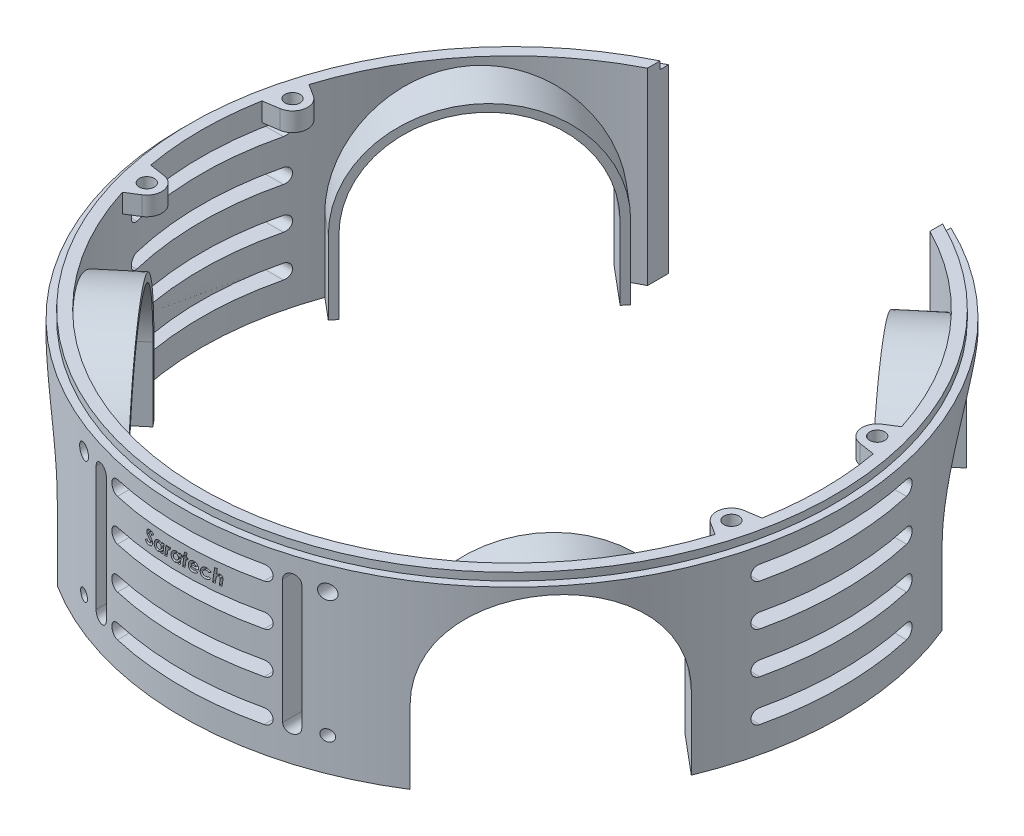
from build123d import *

# Parameters (mm, degrees)
SKETCH1_R                                     = 87.5
BOSS_EXTRUDE1_DEPTH                           = 50
SKETCH3_R                                     = 82.5
CUT_EXTRUDE1_DEPTH                            = 50
SKETCH6_W                                     = 75
SKETCH6_H                                     = 80.665083436
CUT_EXTRUDE2_DEPTH                            = 50
SKETCH7_R                                     = 2
BOSS_EXTRUDE10_DEPTH                          = 5
MIRROR1_AT_THE_SECOND_PLANE_COPY_1_SKETC_R    = 2
MIRROR1_AT_THE_SECOND_PLANE_COPY_1_DEPTH      = 5
CUT_EXTRUDE3_DEPTH                            = 134.46347815
BOSS_EXTRUDE11_REACH                          = 201.927
BOSS_EXTRUDE11_END_RADIUS                     = 82.5
MIRROR2_AT_THE_SECOND_PLANE_COPY_1_DEPTH      = 134.46347815
MIRROR2_AT_THE_SECOND_PLANE_COPY_2_REACH      = 201.927
MIRROR2_AT_THE_SECOND_PLANE_COPY_2_END_RADIUS = 82.5
CUT_EXTRUDE4_START                            = -2
SKETCH13_R                                    = 87.5
SKETCH13_R_2                                  = 85.5
CUT_EXTRUDE4_DEPTH                            = 2
CUT_EXTRUDE5_START                            = -157
CUT_EXTRUDE5_DEPTH                            = 313
CIRPATTERN1_COUNT                             = 2
CIRPATTERN1_ANGLE                             = 90
SKETCH15_R                                    = 1.9467493
SKETCH15_R_2                                  = 1.5
CUT_EXTRUDE6_DEPTH                            = 122


with BuildPart() as part:
    # Sketch1 → Boss-Extrude1 (new body)
    with BuildSketch(Plane(origin=(0, 0, 0), x_dir=(1, 0, 0), z_dir=(0, 1, 0))):
        with Locations(Location((0, 0, 0), (0, 0, 270))):
            Circle(SKETCH1_R)
    extrude(amount=BOSS_EXTRUDE1_DEPTH)

    # Sketch3 → Cut-Extrude1 (cut)
    with BuildSketch(Plane(origin=(0, 50, 0), x_dir=(1, 0, 0), z_dir=(0, 1, 0))):
        with Locations(Location((0, 0, 0), (0, 0, 270))):
            Circle(SKETCH3_R)
    extrude(amount=-CUT_EXTRUDE1_DEPTH, mode=Mode.SUBTRACT)

    # Sketch6 → Cut-Extrude2 (cut)
    with BuildSketch(Plane(origin=(0, 50, 0), x_dir=(1, 0, 0), z_dir=(0, 1, 0))):
        with Locations((0, 79.056941504)):
            Rectangle(SKETCH6_W, SKETCH6_H)
    extrude(amount=-CUT_EXTRUDE2_DEPTH, mode=Mode.SUBTRACT)

    # Sketch7 → Boss-Extrude10 (add)
    with BuildSketch(Plane(origin=(0, 50, 0), x_dir=(1, 0, 0), z_dir=(0, 1, 0))):
        with BuildLine():
            Line((-77.02286612, 15.399127899), (-81.167181464, 14.769517704))
            ThreePointArc((-81.167181464, 14.769517704), (-80.086745592, 19.808159443), (-78.693843423, 24.769517704))
            Line((-78.693843423, 24.769517704), (-75.481017933, 22.731486556))
            ThreePointArc((-75.481017933, 22.731486556), (-73.709264681, 18.530633102), (-77.02286612, 15.399127899))
        make_face()
        with Locations(Location((-77.623658102, 19.353751648, 0), (0, 0, 270))):
            Circle(SKETCH7_R, mode=Mode.SUBTRACT)
    boss_extrude10 = extrude(amount=-BOSS_EXTRUDE10_DEPTH)

    # Mirror1: Boss-Extrude10 across plane
    add(boss_extrude10.mirror(Plane(origin=(0, 0, 0), x_dir=(0, 0, 1), z_dir=(1, 0, 0))))

    # Mirror1 at the second plane: Boss-Extrude10 across plane
    add(boss_extrude10.mirror(Plane.XY))

    # Mirror1 at the second plane copy 1 sketc → Mirror1 at the second plane copy 1 (add)
    with BuildSketch(Plane(origin=(0, 50, 0), x_dir=(-1, 0, 0), z_dir=(0, 1, 0))):
        with BuildLine():
            Line((-77.02286612, 15.399127899), (-81.167181464, 14.769517704))
            ThreePointArc((-81.167181464, 14.769517704), (-80.086745592, 19.808159443), (-78.693843423, 24.769517704))
            Line((-78.693843423, 24.769517704), (-75.481017933, 22.731486556))
            ThreePointArc((-75.481017933, 22.731486556), (-73.709264681, 18.530633102), (-77.02286612, 15.399127899))
        make_face()
        with Locations(Location((-77.623658102, 19.353751648, 0), (0, 0, 270))):
            Circle(MIRROR1_AT_THE_SECOND_PLANE_COPY_1_SKETC_R, mode=Mode.SUBTRACT)
    extrude(amount=-MIRROR1_AT_THE_SECOND_PLANE_COPY_1_DEPTH)

    # Sketch9 → Cut-Extrude3 (cut, through all)
    with BuildSketch(Plane(origin=(0, 0, 0), x_dir=(0, 1, 0), z_dir=(0.7660444431189792, 0, 0.6427876096865379))):
        with BuildLine():
            Line((19.5, 26.5), (0, 26.5))
            Line((0, 26.5), (0, -26.5))
            Line((0, -26.5), (19.5, -26.5))
            ThreePointArc((19.5, -26.5), (46, 0), (19.5, 26.5))
        make_face()
    cut_extrude3 = extrude(amount=-CUT_EXTRUDE3_DEPTH, mode=Mode.SUBTRACT)

    # Boss-Extrude11: up to this cylinder (the profile starts inside it)
    boss_extrude11_end = Plane(origin=(0, 9.75, 0), z_dir=(0, 1, 0)) * Cylinder(BOSS_EXTRUDE11_END_RADIUS, 569.854, mode=Mode.PRIVATE)
    # Sketch10 → Boss-Extrude11 (add, up to the surface)
    with BuildSketch(Plane(origin=(-53.623111018, 0, -44.995132678), x_dir=(0, 1, 0), z_dir=(0.7660444431189792, 0, 0.6427876096865379)), mode=Mode.PRIVATE) as boss_extrude11_sk1:
        with BuildLine():
            Line((19.5, -26.5), (0, -26.5))
            Line((0, -26.5), (0, -28.5))
            Line((0, -28.5), (19.5, -28.5))
            ThreePointArc((19.5, -28.5), (48, 0), (19.5, 28.5))
            Line((19.5, 28.5), (0, 28.5))
            Line((0, 28.5), (0, 26.5))
            Line((0, 26.5), (19.5, 26.5))
            ThreePointArc((19.5, 26.5), (46, 0), (19.5, -26.5))
        make_face()
    boss_extrude11_tool1 = extrude(boss_extrude11_sk1.sketch, amount=-BOSS_EXTRUDE11_REACH, mode=Mode.PRIVATE) & boss_extrude11_end
    boss_extrude11 = boss_extrude11_tool1.solids().sort_by_distance((-36.110244, 9.75, -65.866155))[0]
    add(boss_extrude11)

    # Mirror2: Cut-Extrude3, Boss-Extrude11 across plane
    add(cut_extrude3.mirror(Plane.XY), mode=Mode.SUBTRACT)
    add(boss_extrude11.mirror(Plane.XY))

    # Mirror2 at the second plane: Cut-Extrude3, Boss-Extrude11 across plane
    add(cut_extrude3.mirror(Plane(origin=(0, 0, 0), x_dir=(0, 0, 1), z_dir=(1, 0, 0))), mode=Mode.SUBTRACT)
    add(boss_extrude11.mirror(Plane(origin=(0, 0, 0), x_dir=(0, 0, 1), z_dir=(1, 0, 0))))

    # Mirror2 at the second plane copy 1 sketc → Mirror2 at the second plane copy 1 (cut, through all)
    with BuildSketch(Plane(origin=(0, 0, 0), x_dir=(0, 1, 0), z_dir=(-0.7660444431189792, 0, -0.6427876096865379))):
        with BuildLine():
            Line((19.5, 26.5), (0, 26.5))
            Line((0, 26.5), (0, -26.5))
            Line((0, -26.5), (19.5, -26.5))
            ThreePointArc((19.5, -26.5), (46, 0), (19.5, 26.5))
        make_face()
    extrude(amount=-MIRROR2_AT_THE_SECOND_PLANE_COPY_1_DEPTH, mode=Mode.SUBTRACT)

    # Mirror2 at the second plane copy 2: up to this cylinder (the profile starts inside it)
    mirror2_at_the_second_plane_copy_2_end = Plane(origin=(0, 9.75, 0), z_dir=(0, 1, 0)) * Cylinder(MIRROR2_AT_THE_SECOND_PLANE_COPY_2_END_RADIUS, 569.854, mode=Mode.PRIVATE)
    # Mirror2 at the second plane copy 2 sketc → Mirror2 at the second plane copy 2 (add, up to the surface)
    with BuildSketch(Plane(origin=(53.623111018, 0, 44.995132678), x_dir=(0, 1, 0), z_dir=(-0.7660444431189792, 0, -0.6427876096865379)), mode=Mode.PRIVATE) as mirror2_at_the_second_plane_copy_2_sk1:
        with BuildLine():
            Line((19.5, -26.5), (0, -26.5))
            Line((0, -26.5), (0, -28.5))
            Line((0, -28.5), (19.5, -28.5))
            ThreePointArc((19.5, -28.5), (48, 0), (19.5, 28.5))
            Line((19.5, 28.5), (0, 28.5))
            Line((0, 28.5), (0, 26.5))
            Line((0, 26.5), (19.5, 26.5))
            ThreePointArc((19.5, 26.5), (46, 0), (19.5, -26.5))
        make_face()
    mirror2_at_the_second_plane_copy_2_tool1 = extrude(mirror2_at_the_second_plane_copy_2_sk1.sketch, amount=-MIRROR2_AT_THE_SECOND_PLANE_COPY_2_REACH, mode=Mode.PRIVATE) & mirror2_at_the_second_plane_copy_2_end
    add(mirror2_at_the_second_plane_copy_2_tool1.solids().sort_by_distance((-36.110244, 9.75, -65.866155))[0])

    # Sketch13 → Cut-Extrude4 (cut)
    with BuildSketch(Plane(origin=(0, 50, 0), x_dir=(1, 0, 0), z_dir=(0, 1, 0)).offset(CUT_EXTRUDE4_START)):
        Circle(SKETCH13_R)
        Circle(SKETCH13_R_2, mode=Mode.SUBTRACT)
    extrude(amount=CUT_EXTRUDE4_DEPTH, mode=Mode.SUBTRACT)

    # Sketch14 → Cut-Extrude5 (cut)
    with BuildSketch(Plane(origin=(0, 0, 0), x_dir=(0, 0, -1), z_dir=(1, 0, 0)).offset(CUT_EXTRUDE5_START)):
        with BuildLine():
            Line((-19.463993696, 43.831380894), (19.463993696, 43.831380894))
            ThreePointArc((19.463993696, 43.831380894), (21.410742996, 41.884631594), (19.463993696, 39.937882294))
            Line((19.463993696, 39.937882294), (-19.463993696, 39.937882294))
            ThreePointArc((-19.463993696, 39.937882294), (-21.410742996, 41.884631594), (-19.463993696, 43.831380894))
        make_face()
        with BuildLine():
            Line((-19.463993696, 28.937882294), (19.463993696, 28.937882294))
            ThreePointArc((19.463993696, 28.937882294), (21.410742996, 30.884631594), (19.463993696, 32.831380894))
            Line((19.463993696, 32.831380894), (-19.463993696, 32.831380894))
            ThreePointArc((-19.463993696, 32.831380894), (-21.410742996, 30.884631594), (-19.463993696, 28.937882294))
        make_face()
        with BuildLine():
            Line((-19.463993696, 17.937882294), (19.463993696, 17.937882294))
            ThreePointArc((19.463993696, 17.937882294), (21.410742996, 19.884631594), (19.463993696, 21.831380894))
            Line((19.463993696, 21.831380894), (-19.463993696, 21.831380894))
            ThreePointArc((-19.463993696, 21.831380894), (-21.410742996, 19.884631594), (-19.463993696, 17.937882294))
        make_face()
        with BuildLine():
            Line((-19.463993696, 6.937882294), (19.463993696, 6.937882294))
            ThreePointArc((19.463993696, 6.937882294), (21.410742996, 8.884631594), (19.463993696, 10.831380894))
            Line((19.463993696, 10.831380894), (-19.463993696, 10.831380894))
            ThreePointArc((-19.463993696, 10.831380894), (-21.410742996, 8.884631594), (-19.463993696, 6.937882294))
        make_face()
    cut_extrude5 = extrude(amount=CUT_EXTRUDE5_DEPTH, mode=Mode.SUBTRACT)

    # CirPattern1: Cut-Extrude5 ×2 about axis
    cirpattern1_axis = Axis((0, 0, 0), (0, -1, 0))
    for i in range(1, CIRPATTERN1_COUNT):
        add(cut_extrude5.rotate(cirpattern1_axis, i * CIRPATTERN1_ANGLE / (CIRPATTERN1_COUNT - 1)), mode=Mode.SUBTRACT)

    # Sketch15 → Cut-Extrude6 (cut)
    # profile 1 of 14: a face of its own
    with BuildSketch(Plane.XY):
        with Locations(Location((32.357492296, 41.884631594, 0), (0, 0, 180))):
            Circle(SKETCH15_R)
    # profile 2 of 14: a face of its own
    with BuildSketch(Plane.XY):
        with Locations(Location((32.357492296, 8.884631594, 0), (0, 0, 180))):
            Circle(SKETCH15_R_2)
    # profile 3 of 14: a face of its own
    with BuildSketch(Plane.XY):
        with Locations(Location((-32.357492296, 8.884631594, 0), (0, 0, 180))):
            Circle(SKETCH15_R_2)
    # profile 4 of 14: a face of its own
    with BuildSketch(Plane.XY):
        with Locations(Location((-32.357492296, 41.884631594, 0), (0, 0, 180))):
            Circle(SKETCH15_R)
    # profile 5 of 14: a face of its own
    with BuildSketch(Plane.XY):
        with BuildLine():
            Line((-23.410742996, 41.884631594), (-23.410742996, 8.884631594))
            ThreePointArc((-23.410742996, 8.884631594), (-25.357492296, 6.937882294), (-27.304241596, 8.884631594))
            Line((-27.304241596, 8.884631594), (-27.304241596, 41.884631594))
            ThreePointArc((-27.304241596, 41.884631594), (-25.357492296, 43.831380894), (-23.410742996, 41.884631594))
        make_face()
    # profile 6 of 14: a face of its own
    with BuildSketch(Plane.XY):
        with BuildLine():
            Line((23.410742996, 41.884631594), (23.410742996, 8.884631594))
            ThreePointArc((23.410742996, 8.884631594), (25.357492296, 6.937882294), (27.304241596, 8.884631594))
            Line((27.304241596, 8.884631594), (27.304241596, 41.884631594))
            ThreePointArc((27.304241596, 41.884631594), (25.357492296, 43.831380894), (23.410742996, 41.884631594))
        make_face()
    # profile 7 of 14: a face of its own
    with BuildSketch(Plane.XY):
        with BuildLine():
            Line((-8.084392004, 37.731021426), (-8.570970529, 37.30684274))
            add(Edge.make_bspline(
                [(-8.570970529, 37.30684274), (-8.59528857, 37.339692663), (-8.641893646, 37.402648934), (-8.715846339, 37.487090258), (-8.786695733, 37.560468751), (-8.858061527, 37.618984947), (-8.927622856, 37.665384903), (-8.995985893, 37.698996081), (-9.063534914, 37.720235709), (-9.108592898, 37.722776711), (-9.130465722, 37.724010208)],
                knots=[0, 0, 0, 0, 1.358515141, 2.603569235, 3.730126198, 4.746094498, 5.666493297, 6.504166865, 7.273866877, 8, 8, 8, 8], degree=3))
            add(Edge.make_bspline(
                [(-9.130465722, 37.724010208), (-9.151126472, 37.723115742), (-9.190859848, 37.721395565), (-9.247894466, 37.706729981), (-9.299731485, 37.683139484), (-9.344235642, 37.649012923), (-9.38140546, 37.609666408), (-9.409004554, 37.565512278), (-9.425077909, 37.516844696), (-9.427305908, 37.483173957), (-9.428442484, 37.465997388)],
                knots=[0, 0, 0, 0, 1.130304997, 2.173727141, 3.204821236, 4.229135679, 5.225705988, 6.15679035, 7.05971714, 8, 8, 8, 8], degree=3))
            add(Edge.make_bspline(
                [(-9.428442484, 37.465997388), (-9.427407379, 37.449076049), (-9.42523024, 37.413485365), (-9.409279374, 37.359530429), (-9.385151579, 37.302680665), (-9.356131008, 37.253249721), (-9.323547158, 37.208364882), (-9.289401325, 37.164445404), (-9.244815931, 37.111934269), (-9.190563034, 37.050230267), (-9.127160939, 36.978812777), (-9.052965201, 36.898720932), (-8.969311745, 36.809428724), (-8.909894396, 36.747068254), (-8.878762997, 36.714394823)],
                knots=[0, 0, 0, 0, 0.642317819, 1.35098826, 2.122816345, 2.986294386, 3.520967692, 4.229638134, 5.099348126, 6.137609051, 7.351336444, 8.727500291, 10.285391505, 12, 12, 12, 12], degree=3))
            add(Edge.make_bspline(
                [(-8.878762997, 36.714394823), (-8.861875011, 36.69692504), (-8.829470247, 36.663403921), (-8.78400207, 36.614447423), (-8.743420788, 36.569074046), (-8.705952519, 36.528872928), (-8.673877282, 36.491768355), (-8.646491082, 36.458650523), (-8.623241851, 36.429985447), (-8.609496663, 36.412005514), (-8.603222132, 36.403797868)],
                knots=[0, 0, 0, 0, 1.403722598, 2.693470914, 3.859630393, 4.920438112, 5.867965235, 6.69256451, 7.40316977, 8, 8, 8, 8], degree=3))
            add(Edge.make_bspline(
                [(-8.603222132, 36.403797868), (-8.578236564, 36.369280001), (-8.530046852, 36.302705325), (-8.467541217, 36.201483467), (-8.41584208, 36.103958145), (-8.375216966, 36.008975158), (-8.344826696, 35.915495623), (-8.32281593, 35.821974323), (-8.308950895, 35.727633351), (-8.307413113, 35.664160403), (-8.306647613, 35.632563894)],
                knots=[0, 0, 0, 0, 1.215130546, 2.343624586, 3.390252636, 4.360992906, 5.286454858, 6.190345157, 7.099163061, 8, 8, 8, 8], degree=3))
            add(Edge.make_bspline(
                [(-8.306647613, 35.632563894), (-8.307600189, 35.597690223), (-8.309474864, 35.529058664), (-8.324001291, 35.428363271), (-8.346627322, 35.331812535), (-8.380366167, 35.239986518), (-8.422025404, 35.151885992), (-8.47489983, 35.068801043), (-8.535725056, 34.989325875), (-8.605944287, 34.915338059), (-8.682800363, 34.847676538), (-8.766488132, 34.789083916), (-8.854946032, 34.739141474), (-8.949073286, 34.698025426), (-9.048583062, 34.6667533), (-9.15329784, 34.644510463), (-9.263024315, 34.629745748), (-9.338181787, 34.628495021), (-9.376559472, 34.627856362)],
                knots=[0, 0, 0, 0, 1.018989505, 2.005376454, 2.968035412, 3.912365187, 4.859556873, 5.811049809, 6.78527381, 7.780773345, 8.787785161, 9.773320145, 10.761314359, 11.752515283, 12.770107012, 13.804505292, 14.878913802, 16, 16, 16, 16], degree=3))
            add(Edge.make_bspline(
                [(-9.376559472, 34.627856362), (-9.40602215, 34.628446705), (-9.464346259, 34.629615344), (-9.550793265, 34.63737452), (-9.63514424, 34.650620444), (-9.717275227, 34.669735295), (-9.797357716, 34.693602903), (-9.875516558, 34.722251872), (-9.951556188, 34.756928111), (-10.025573987, 34.796729932), (-10.097576797, 34.841812999), (-10.167132575, 34.892715065), (-10.23499178, 34.94845453), (-10.300264997, 35.010087056), (-10.364330374, 35.075911369), (-10.426065813, 35.147424899), (-10.484850985, 35.224927376), (-10.522167884, 35.279050667), (-10.541122773, 35.306542259)],
                knots=[0, 0, 0, 0, 1.003438088, 1.986398949, 2.953471805, 3.909242729, 4.856156023, 5.798037682, 6.742035895, 7.700024963, 8.658509928, 9.632892881, 10.633707184, 11.647385023, 12.688779161, 13.761077638, 14.862753205, 16, 16, 16, 16], degree=3))
            Line((-10.541122773, 35.306542259), (-10.022993767, 35.713894022))
            add(Edge.make_bspline(
                [(-10.022993767, 35.713894022), (-9.997186529, 35.674212077), (-9.947689888, 35.598104629), (-9.867012646, 35.495373061), (-9.784762534, 35.408062687), (-9.700640906, 35.336512982), (-9.614377123, 35.280841805), (-9.526590417, 35.241047601), (-9.436890089, 35.21545203), (-9.376022386, 35.212606685), (-9.345710113, 35.211189695)],
                knots=[0, 0, 0, 0, 1.289844872, 2.473840458, 3.555310637, 4.554525788, 5.477014656, 6.343795492, 7.175205895, 8, 8, 8, 8], degree=3))
            add(Edge.make_bspline(
                [(-9.345710113, 35.211189695), (-9.317741816, 35.212415414), (-9.263296233, 35.214801509), (-9.185412082, 35.237017692), (-9.113956326, 35.271265378), (-9.052094275, 35.320165693), (-8.999979831, 35.377595847), (-8.962097285, 35.443021089), (-8.939291065, 35.514705771), (-8.936354401, 35.564389664), (-8.934852741, 35.589795464)],
                knots=[0, 0, 0, 0, 1.07813582, 2.098795369, 3.104167493, 4.120866408, 5.124778177, 6.083335831, 7.019916046, 8, 8, 8, 8], degree=3))
            add(Edge.make_bspline(
                [(-8.934852741, 35.589795464), (-8.935570121, 35.610445307), (-8.937029403, 35.652450892), (-8.952241035, 35.715013612), (-8.974817613, 35.778451927), (-9.002181087, 35.83206689), (-9.031694369, 35.879080159), (-9.062949226, 35.921654005), (-9.102276797, 35.971625739), (-9.15093053, 36.027822435), (-9.206921603, 36.092141292), (-9.272371522, 36.162321847), (-9.345189129, 36.240686583), (-9.39747281, 36.294303395), (-9.424936875, 36.32246774)],
                knots=[0, 0, 0, 0, 0.82235112, 1.672813781, 2.554588539, 3.50524042, 4.06657461, 4.767804758, 5.610876414, 6.602916144, 7.732569792, 9.01260869, 10.430754915, 12, 12, 12, 12], degree=3))
            add(Edge.make_bspline(
                [(-9.424936875, 36.32246774), (-9.454004804, 36.352531701), (-9.510197756, 36.410650144), (-9.589695736, 36.495706098), (-9.66130452, 36.574871571), (-9.724943025, 36.648229865), (-9.780663818, 36.715912847), (-9.829431065, 36.777407061), (-9.869768725, 36.833523705), (-9.892518916, 36.869933522), (-9.90310194, 36.886870785)],
                knots=[0, 0, 0, 0, 1.354401886, 2.618275412, 3.770529779, 4.811580489, 5.763301005, 6.60974666, 7.35327647, 8, 8, 8, 8], degree=3))
            add(Edge.make_bspline(
                [(-9.90310194, 36.886870785), (-9.926731814, 36.929075873), (-9.972577851, 37.010961029), (-10.019841716, 37.139840603), (-10.050641721, 37.267064414), (-10.054668047, 37.352015274), (-10.056647613, 37.393781843)],
                knots=[0, 0, 0, 0, 1.081804801, 2.098888081, 3.065307629, 4, 4, 4, 4], degree=3))
            add(Edge.make_bspline(
                [(-10.056647613, 37.393781843), (-10.055936816, 37.420690494), (-10.05452291, 37.474216828), (-10.044343873, 37.553214656), (-10.0287582, 37.63046244), (-10.003912067, 37.704788468), (-9.975257309, 37.778053866), (-9.937801983, 37.848333511), (-9.895720787, 37.917518152), (-9.861960343, 37.960376437), (-9.844908831, 37.982023029)],
                knots=[0, 0, 0, 0, 1.012167245, 2.013389743, 2.992947912, 3.971795425, 4.958040075, 5.949133471, 6.964161297, 8, 8, 8, 8], degree=3))
            add(Edge.make_bspline(
                [(-9.844908831, 37.982023029), (-9.822399358, 38.008111342), (-9.778002566, 38.059566899), (-9.701187687, 38.125341725), (-9.619742556, 38.18215621), (-9.531914023, 38.22776679), (-9.43871204, 38.264118953), (-9.339250189, 38.28878633), (-9.23429073, 38.304901423), (-9.162312038, 38.30651805), (-9.125557869, 38.307343541)],
                knots=[0, 0, 0, 0, 1.010152455, 1.992384693, 2.959065588, 3.919519142, 4.890305168, 5.888624478, 6.921877408, 8, 8, 8, 8], degree=3))
            add(Edge.make_bspline(
                [(-9.125557869, 38.307343541), (-9.074732478, 38.305569152), (-8.974471958, 38.302068909), (-8.826973853, 38.274863365), (-8.686416766, 38.228747643), (-8.551394963, 38.16609195), (-8.424100765, 38.083578024), (-8.302834117, 37.983833895), (-8.187661934, 37.86614861), (-8.119456672, 37.776903028), (-8.084392004, 37.731021426)],
                knots=[0, 0, 0, 0, 0.984438778, 1.941949542, 2.894274057, 3.844399604, 4.817935388, 5.825099055, 6.88187249, 8, 8, 8, 8], degree=3))
        make_face()
    # profile 8 of 14: a face of its own
    with BuildSketch(Plane.XY):
        with BuildLine():
            Line((-5.655004984, 37.275292259), (-5.02048976, 37.275292259))
            Line((-5.02048976, 37.275292259), (-5.38367085, 34.717599952))
            Line((-5.38367085, 34.717599952), (-6.018186074, 34.717599952))
            Line((-6.018186074, 34.717599952), (-5.974015401, 35.030300272))
            add(Edge.make_bspline(
                [(-5.974015401, 35.030300272), (-6.006972033, 34.998930039), (-6.069814483, 34.939112569), (-6.167146274, 34.861509269), (-6.260839522, 34.798396094), (-6.353210501, 34.749989105), (-6.446796385, 34.714869052), (-6.543938822, 34.69054379), (-6.646613078, 34.675330351), (-6.716916223, 34.673610137), (-6.752961715, 34.672728157)],
                knots=[0, 0, 0, 0, 1.236324186, 2.357450916, 3.379388742, 4.30284698, 5.185433758, 6.089881904, 7.020653398, 8, 8, 8, 8], degree=3))
            add(Edge.make_bspline(
                [(-6.752961715, 34.672728157), (-6.794162537, 34.673687986), (-6.874852175, 34.675567762), (-6.992556083, 34.693758481), (-7.103828228, 34.722208375), (-7.208721008, 34.762352046), (-7.306667652, 34.814750942), (-7.398605898, 34.878270954), (-7.483704357, 34.953694023), (-7.560795939, 35.040022492), (-7.630320758, 35.133068096), (-7.690793332, 35.2313901), (-7.743302799, 35.332688074), (-7.784173303, 35.438812624), (-7.817911504, 35.547779008), (-7.840497115, 35.661040517), (-7.855066474, 35.777783953), (-7.856967882, 35.856878627), (-7.857929664, 35.896886811)],
                knots=[0, 0, 0, 0, 1.072254913, 2.099954687, 3.093402483, 4.05863531, 5.017013142, 5.979305845, 6.962352722, 7.970695896, 8.988290287, 9.983079422, 10.973839091, 11.95483031, 12.940586347, 13.940815436, 14.958409826, 16, 16, 16, 16], degree=3))
            add(Edge.make_bspline(
                [(-7.857929664, 35.896886811), (-7.857447078, 35.927758657), (-7.856487068, 35.989172216), (-7.84700534, 36.0807776), (-7.83155604, 36.171135553), (-7.81033769, 36.260545919), (-7.783889273, 36.348984181), (-7.750826936, 36.436132499), (-7.711167765, 36.521815397), (-7.666589008, 36.606135438), (-7.617383552, 36.688075647), (-7.562186047, 36.764983656), (-7.504243617, 36.838265012), (-7.441697675, 36.906482865), (-7.374705853, 36.969414515), (-7.304649122, 37.0290444), (-7.229271624, 37.082483607), (-7.15122763, 37.1325232), (-7.07006381, 37.176093959), (-6.987979768, 37.215248524), (-6.904341465, 37.247167613), (-6.820203655, 37.274187321), (-6.734832911, 37.294477853), (-6.648646073, 37.30906276), (-6.561541837, 37.318741973), (-6.503154062, 37.319689541), (-6.473915241, 37.320164054)],
                knots=[0, 0, 0, 0, 1.010861959, 2.01091412, 3.012605424, 4.011485121, 5.018863341, 6.033918867, 7.061452407, 8.109228878, 9.15680961, 10.18900835, 11.207521355, 12.215190347, 13.216881651, 14.216552911, 15.225616441, 16.240671966, 17.251099115, 18.240697123, 19.217272556, 20.180771028, 21.133199006, 22.08832996, 23.042693801, 24, 24, 24, 24], degree=3))
            add(Edge.make_bspline(
                [(-6.473915241, 37.320164054), (-6.435031333, 37.319056242), (-6.358385569, 37.316872585), (-6.246126638, 37.296402465), (-6.138584683, 37.264026686), (-6.036025905, 37.219129816), (-5.939710701, 37.161921272), (-5.852451643, 37.091452184), (-5.772277087, 37.010678382), (-5.728453028, 36.948108461), (-5.706186875, 36.9163179)],
                knots=[0, 0, 0, 0, 1.030509072, 2.031281277, 3.015697838, 4.003854478, 4.993584726, 5.977161716, 6.972235198, 8, 8, 8, 8], degree=3))
            Line((-5.706186875, 36.9163179), (-5.655004984, 37.275292259))
        make_face()
        with BuildLine():
            add(Edge.make_bspline(
                [(-6.612036234, 35.25606149), (-6.575487508, 35.257191159), (-6.504210672, 35.259394223), (-6.401234732, 35.278909805), (-6.305275486, 35.309641821), (-6.216477932, 35.353573305), (-6.134536698, 35.411352324), (-6.060157915, 35.483464887), (-5.992978165, 35.56985071), (-5.934062667, 35.667907157), (-5.884825227, 35.773366005), (-5.84874975, 35.882240499), (-5.825743448, 35.992440918), (-5.823160472, 36.066682714), (-5.821871972, 36.10371774)],
                knots=[0, 0, 0, 0, 1.017901168, 1.985097214, 2.910041334, 3.818973104, 4.735274743, 5.693545178, 6.695670165, 7.777101795, 8.875856117, 9.932619244, 10.968700869, 12, 12, 12, 12], degree=3))
            add(Edge.make_bspline(
                [(-5.821871972, 36.10371774), (-5.822461407, 36.126873719), (-5.823619776, 36.172380307), (-5.831191728, 36.238833271), (-5.84450273, 36.30178398), (-5.863601722, 36.361193543), (-5.887997814, 36.417125852), (-5.917871814, 36.469744879), (-5.952797146, 36.518682189), (-5.99294111, 36.563895982), (-6.037802102, 36.603953521), (-6.085367216, 36.640677254), (-6.137847717, 36.669514515), (-6.192699723, 36.694678527), (-6.251422159, 36.71324034), (-6.313215855, 36.727702857), (-6.378852963, 36.735053821), (-6.423653346, 36.73622936), (-6.446571491, 36.736830721)],
                knots=[0, 0, 0, 0, 1.109141645, 2.179707075, 3.198451464, 4.18615572, 5.163657463, 6.116161664, 7.079133258, 8.038519567, 9.005387219, 9.956904198, 10.909408399, 11.866440704, 12.843493655, 13.853714903, 14.902043453, 16, 16, 16, 16], degree=3))
            add(Edge.make_bspline(
                [(-6.446571491, 36.736830721), (-6.473259692, 36.736248168), (-6.525945661, 36.735098134), (-6.603367061, 36.723220493), (-6.678040216, 36.705485717), (-6.749242137, 36.678946426), (-6.817715734, 36.646236189), (-6.88239629, 36.604908993), (-6.944541341, 36.557022126), (-7.002831463, 36.502120957), (-7.055999319, 36.441374442), (-7.102532552, 36.375841688), (-7.142131825, 36.305896383), (-7.174398609, 36.231647901), (-7.198828512, 36.15277805), (-7.217210494, 36.070305974), (-7.2277977, 35.983166685), (-7.229071915, 35.923791607), (-7.229724536, 35.893381202)],
                knots=[0, 0, 0, 0, 0.994897251, 1.964056203, 2.915642991, 3.853470011, 4.79324038, 5.741466074, 6.711095529, 7.716481674, 8.723680824, 9.71796663, 10.70964959, 11.717112863, 12.731868792, 13.785363818, 14.865719672, 16, 16, 16, 16], degree=3))
            add(Edge.make_bspline(
                [(-7.229724536, 35.893381202), (-7.22912458, 35.869995076), (-7.227951318, 35.824261564), (-7.220573544, 35.757244243), (-7.206206065, 35.694007531), (-7.187339793, 35.634139581), (-7.163539487, 35.577582743), (-7.133895565, 35.524682764), (-7.098602401, 35.475340869), (-7.05816828, 35.429958111), (-7.013143606, 35.389556831), (-6.965429515, 35.353254825), (-6.914002074, 35.323198183), (-6.859563273, 35.298343781), (-6.801913748, 35.279457114), (-6.74125785, 35.266425616), (-6.677735726, 35.257512591), (-6.63427027, 35.256552572), (-6.612036234, 35.25606149)],
                knots=[0, 0, 0, 0, 1.124431694, 2.198919568, 3.234766021, 4.236791382, 5.213425507, 6.179206721, 7.145706547, 8.12447102, 9.094881178, 10.04988442, 11.001776355, 11.952075609, 12.922030374, 13.911569148, 14.931697721, 16, 16, 16, 16], degree=3))
        make_face(mode=Mode.SUBTRACT)
    # profile 9 of 14: a face of its own
    with BuildSketch(Plane.XY):
        with BuildLine():
            Line((-4.488338318, 37.275292259), (-3.89939601, 37.275292259))
            Line((-3.89939601, 37.275292259), (-3.944968927, 36.9163179))
            add(Edge.make_bspline(
                [(-3.944968927, 36.9163179), (-3.923804733, 36.948277161), (-3.883019466, 37.009865474), (-3.814665869, 37.092561906), (-3.743015699, 37.162467876), (-3.66824426, 37.220226707), (-3.589875491, 37.264872204), (-3.508243395, 37.296890998), (-3.423332771, 37.316583577), (-3.365477804, 37.318966303), (-3.336395209, 37.320164054)],
                knots=[0, 0, 0, 0, 1.203274242, 2.318815539, 3.362160423, 4.341361458, 5.27818761, 6.184615762, 7.087440759, 8, 8, 8, 8], degree=3))
            add(Edge.make_bspline(
                [(-3.336395209, 37.320164054), (-3.32209968, 37.319598565), (-3.292806681, 37.318439819), (-3.248595156, 37.309518078), (-3.203389185, 37.295592155), (-3.174067936, 37.282179628), (-3.159011395, 37.275292259)],
                knots=[0, 0, 0, 0, 0.929430428, 1.904497954, 2.92395396, 4, 4, 4, 4], degree=3))
            Line((-3.159011395, 37.275292259), (-3.40720851, 36.705981362))
            add(Edge.make_bspline(
                [(-3.40720851, 36.705981362), (-3.418625164, 36.710512777), (-3.439659158, 36.718861438), (-3.469196527, 36.729110537), (-3.494162543, 36.734960141), (-3.509319674, 36.73626552), (-3.515882388, 36.736830721)],
                knots=[0, 0, 0, 0, 1.298729578, 2.392773935, 3.304105365, 4, 4, 4, 4], degree=3))
            add(Edge.make_bspline(
                [(-3.515882388, 36.736830721), (-3.531596877, 36.736138517), (-3.562634562, 36.734771345), (-3.60837046, 36.724321247), (-3.653016473, 36.708116242), (-3.696621904, 36.684984088), (-3.738121198, 36.65396744), (-3.778885096, 36.617514959), (-3.818317734, 36.574295938), (-3.85678629, 36.523702187), (-3.894108459, 36.46320113), (-3.92697361, 36.389266271), (-3.959020692, 36.302797557), (-3.990064536, 36.203002682), (-4.01724236, 36.089190172), (-4.044020246, 35.962303279), (-4.068435255, 35.821972709), (-4.082213853, 35.723753568), (-4.089400017, 35.672527836)],
                knots=[0, 0, 0, 0, 0.576935763, 1.139505725, 1.715418098, 2.31853603, 2.945453378, 3.61436612, 4.325438415, 5.091425351, 5.947081821, 6.930670679, 8.058330957, 9.334895625, 10.767784451, 12.355934311, 14.099454639, 16, 16, 16, 16], degree=3))
            Line((-4.089400017, 35.672527836), (-4.217705305, 34.717599952))
            Line((-4.217705305, 34.717599952), (-4.851519408, 34.717599952))
            Line((-4.851519408, 34.717599952), (-4.488338318, 37.275292259))
        make_face()
    # profile 10 of 14: a face of its own
    with BuildSketch(Plane.XY):
        with BuildLine():
            Line((-0.898594728, 37.275292259), (-0.264079504, 37.275292259))
            Line((-0.264079504, 37.275292259), (-0.627260593, 34.717599952))
            Line((-0.627260593, 34.717599952), (-1.261775818, 34.717599952))
            Line((-1.261775818, 34.717599952), (-1.217605145, 35.030300272))
            add(Edge.make_bspline(
                [(-1.217605145, 35.030300272), (-1.250561776, 34.998930039), (-1.313404226, 34.939112569), (-1.410736018, 34.861509269), (-1.504429265, 34.798396094), (-1.596800245, 34.749989105), (-1.690386128, 34.714869052), (-1.787528566, 34.69054379), (-1.890202822, 34.675330351), (-1.960505967, 34.673610137), (-1.996551459, 34.672728157)],
                knots=[0, 0, 0, 0, 1.236324186, 2.357450916, 3.379388742, 4.30284698, 5.185433758, 6.089881904, 7.020653398, 8, 8, 8, 8], degree=3))
            add(Edge.make_bspline(
                [(-1.996551459, 34.672728157), (-2.037752281, 34.673687986), (-2.118441918, 34.675567762), (-2.236145827, 34.693758481), (-2.347417971, 34.722208375), (-2.452310751, 34.762352046), (-2.550257396, 34.814750942), (-2.642195641, 34.878270954), (-2.727294101, 34.953694023), (-2.804385682, 35.040022492), (-2.873910502, 35.133068096), (-2.934383076, 35.2313901), (-2.986892542, 35.332688074), (-3.027763047, 35.438812624), (-3.061501248, 35.547779008), (-3.084086859, 35.661040517), (-3.098656217, 35.777783953), (-3.100557625, 35.856878627), (-3.101519408, 35.896886811)],
                knots=[0, 0, 0, 0, 1.072254913, 2.099954687, 3.093402483, 4.05863531, 5.017013142, 5.979305845, 6.962352722, 7.970695896, 8.988290287, 9.983079422, 10.973839091, 11.95483031, 12.940586347, 13.940815436, 14.958409826, 16, 16, 16, 16], degree=3))
            add(Edge.make_bspline(
                [(-3.101519408, 35.896886811), (-3.101036822, 35.927758657), (-3.100076811, 35.989172216), (-3.090595084, 36.0807776), (-3.075145783, 36.171135553), (-3.053927433, 36.260545919), (-3.027479016, 36.348984181), (-2.994416679, 36.436132499), (-2.954757508, 36.521815397), (-2.910178752, 36.606135438), (-2.860973295, 36.688075647), (-2.80577579, 36.764983656), (-2.74783336, 36.838265012), (-2.685287418, 36.906482865), (-2.618295597, 36.969414515), (-2.548238866, 37.0290444), (-2.472861367, 37.082483607), (-2.394817373, 37.1325232), (-2.313653554, 37.176093959), (-2.231569511, 37.215248524), (-2.147931209, 37.247167613), (-2.063793399, 37.274187321), (-1.978422654, 37.294477853), (-1.892235816, 37.30906276), (-1.805131581, 37.318741973), (-1.746743806, 37.319689541), (-1.717504984, 37.320164054)],
                knots=[0, 0, 0, 0, 1.010861959, 2.01091412, 3.012605424, 4.011485121, 5.018863341, 6.033918867, 7.061452407, 8.109228878, 9.15680961, 10.18900835, 11.207521355, 12.215190347, 13.216881651, 14.216552911, 15.225616441, 16.240671966, 17.251099115, 18.240697123, 19.217272556, 20.180771028, 21.133199006, 22.08832996, 23.042693801, 24, 24, 24, 24], degree=3))
            add(Edge.make_bspline(
                [(-1.717504984, 37.320164054), (-1.678621076, 37.319056242), (-1.601975313, 37.316872585), (-1.489716382, 37.296402465), (-1.382174426, 37.264026686), (-1.279615648, 37.219129816), (-1.183300445, 37.161921272), (-1.096041387, 37.091452184), (-1.01586683, 37.010678382), (-0.972042771, 36.948108461), (-0.949776619, 36.9163179)],
                knots=[0, 0, 0, 0, 1.030509072, 2.031281277, 3.015697838, 4.003854478, 4.993584726, 5.977161716, 6.972235198, 8, 8, 8, 8], degree=3))
            Line((-0.949776619, 36.9163179), (-0.898594728, 37.275292259))
        make_face()
        with BuildLine():
            add(Edge.make_bspline(
                [(-1.855625978, 35.25606149), (-1.819077252, 35.257191159), (-1.747800415, 35.259394223), (-1.644824476, 35.278909805), (-1.54886523, 35.309641821), (-1.460067676, 35.353573305), (-1.378126441, 35.411352324), (-1.303747659, 35.483464887), (-1.236567909, 35.56985071), (-1.17765241, 35.667907157), (-1.128414971, 35.773366005), (-1.092339494, 35.882240499), (-1.069333191, 35.992440918), (-1.066750216, 36.066682714), (-1.065461715, 36.10371774)],
                knots=[0, 0, 0, 0, 1.017901168, 1.985097214, 2.910041334, 3.818973104, 4.735274743, 5.693545178, 6.695670165, 7.777101795, 8.875856117, 9.932619244, 10.968700869, 12, 12, 12, 12], degree=3))
            add(Edge.make_bspline(
                [(-1.065461715, 36.10371774), (-1.06605115, 36.126873719), (-1.06720952, 36.172380307), (-1.074781472, 36.238833271), (-1.088092474, 36.30178398), (-1.107191465, 36.361193543), (-1.131587558, 36.417125852), (-1.161461558, 36.469744879), (-1.19638689, 36.518682189), (-1.236530854, 36.563895982), (-1.281391846, 36.603953521), (-1.32895696, 36.640677254), (-1.381437461, 36.669514515), (-1.436289466, 36.694678527), (-1.495011903, 36.71324034), (-1.556805598, 36.727702857), (-1.622442707, 36.735053821), (-1.667243089, 36.73622936), (-1.690161234, 36.736830721)],
                knots=[0, 0, 0, 0, 1.109141645, 2.179707075, 3.198451464, 4.18615572, 5.163657463, 6.116161664, 7.079133258, 8.038519567, 9.005387219, 9.956904198, 10.909408399, 11.866440704, 12.843493655, 13.853714903, 14.902043453, 16, 16, 16, 16], degree=3))
            add(Edge.make_bspline(
                [(-1.690161234, 36.736830721), (-1.716849435, 36.736248168), (-1.769535405, 36.735098134), (-1.846956805, 36.723220493), (-1.92162996, 36.705485717), (-1.99283188, 36.678946426), (-2.061305477, 36.646236189), (-2.125986033, 36.604908993), (-2.188131084, 36.557022126), (-2.246421207, 36.502120957), (-2.299589062, 36.441374442), (-2.346122295, 36.375841688), (-2.385721569, 36.305896383), (-2.417988352, 36.231647901), (-2.442418255, 36.15277805), (-2.460800238, 36.070305974), (-2.471387444, 35.983166685), (-2.472661659, 35.923791607), (-2.473314279, 35.893381202)],
                knots=[0, 0, 0, 0, 0.994897251, 1.964056203, 2.915642991, 3.853470011, 4.79324038, 5.741466074, 6.711095529, 7.716481674, 8.723680824, 9.71796663, 10.70964959, 11.717112863, 12.731868792, 13.785363818, 14.865719672, 16, 16, 16, 16], degree=3))
            add(Edge.make_bspline(
                [(-2.473314279, 35.893381202), (-2.472714324, 35.869995076), (-2.471541062, 35.824261564), (-2.464163288, 35.757244243), (-2.449795809, 35.694007531), (-2.430929537, 35.634139581), (-2.40712923, 35.577582743), (-2.377485309, 35.524682764), (-2.342192144, 35.475340869), (-2.301758024, 35.429958111), (-2.25673335, 35.389556831), (-2.209019258, 35.353254825), (-2.157591817, 35.323198183), (-2.103153016, 35.298343781), (-2.045503492, 35.279457114), (-1.984847594, 35.266425616), (-1.92132547, 35.257512591), (-1.877860014, 35.256552572), (-1.855625978, 35.25606149)],
                knots=[0, 0, 0, 0, 1.124431694, 2.198919568, 3.234766021, 4.236791382, 5.213425507, 6.179206721, 7.145706547, 8.12447102, 9.094881178, 10.04988442, 11.001776355, 11.952075609, 12.922030374, 13.911569148, 14.931697721, 16, 16, 16, 16], degree=3))
        make_face(mode=Mode.SUBTRACT)
    # profile 11 of 14: a face of its own
    with BuildSketch(Plane.XY):
        Polygon((0.537302708, 38.307343541), (1.170415689, 38.307343541), (1.027386842, 37.275292259), (1.427727387, 37.275292259), (1.352006233, 36.736830721), (0.95236681, 36.736830721), (0.672619214, 34.717599952), (0.039506233, 34.717599952), (0.31925383, 36.736830721), (0.009357996, 36.736830721), (0.082274663, 37.275292259), (0.394273862, 37.275292259), align=None)
    # profile 12 of 14: a face of its own
    with BuildSketch(Plane.XY):
        with BuildLine():
            Line((3.399281875, 35.474110368), (3.94826024, 35.192259407))
            add(Edge.make_bspline(
                [(3.94826024, 35.192259407), (3.915828801, 35.153456046), (3.850641448, 35.075461096), (3.733454039, 34.974374371), (3.60234313, 34.884768083), (3.456850564, 34.808994283), (3.299725276, 34.74761857), (3.132769095, 34.704899114), (2.957816999, 34.676900391), (2.838261694, 34.674135816), (2.777386842, 34.672728157)],
                knots=[0, 0, 0, 0, 0.914244933, 1.837636877, 2.790537697, 3.784087733, 4.800790172, 5.83726639, 6.89878507, 8, 8, 8, 8], degree=3))
            add(Edge.make_bspline(
                [(2.777386842, 34.672728157), (2.729894712, 34.673535362), (2.637449142, 34.675106624), (2.502680801, 34.691228711), (2.375324743, 34.71577706), (2.256028246, 34.751877632), (2.14377481, 34.796594521), (2.039949297, 34.852842757), (1.943876013, 34.919488311), (1.855546156, 34.994719546), (1.777057957, 35.079331691), (1.707857257, 35.170379113), (1.650178049, 35.269021267), (1.602051021, 35.373572412), (1.565899273, 35.485507573), (1.538993209, 35.603447958), (1.523697259, 35.728451844), (1.521434242, 35.813880355), (1.520275464, 35.85762399)],
                knots=[0, 0, 0, 0, 1.167516698, 2.272623801, 3.333371772, 4.353538571, 5.333382306, 6.300396664, 7.250661637, 8.204535574, 9.148031545, 10.083792083, 11.011414416, 11.952824574, 12.908912643, 13.898953575, 14.92416002, 16, 16, 16, 16], degree=3))
            add(Edge.make_bspline(
                [(1.520275464, 35.85762399), (1.521312452, 35.907947169), (1.523351938, 36.006919806), (1.544663591, 36.151949206), (1.5774922, 36.29123708), (1.623505018, 36.424704737), (1.684192186, 36.55175549), (1.756146284, 36.673862259), (1.843201244, 36.788836016), (1.941579083, 36.89697042), (2.049112295, 36.995478406), (2.163130197, 37.082549817), (2.283248309, 37.155955716), (2.40857897, 37.216344924), (2.539713557, 37.263244515), (2.676350205, 37.295644193), (2.81831198, 37.317047493), (2.91496148, 37.319116651), (2.96388524, 37.320164054)],
                knots=[0, 0, 0, 0, 1.05529311, 2.075487762, 3.068699193, 4.055083011, 5.031283693, 6.018666653, 7.023995929, 8.051577733, 9.082465902, 10.079966066, 11.057287041, 12.031169187, 12.994424047, 13.973330935, 14.974104677, 16, 16, 16, 16], degree=3))
            add(Edge.make_bspline(
                [(2.96388524, 37.320164054), (2.993575232, 37.319505101), (3.052100675, 37.318206161), (3.13882077, 37.311504036), (3.222737803, 37.298428237), (3.304450211, 37.282142325), (3.383282408, 37.259353835), (3.459666071, 37.231772372), (3.534389612, 37.200723207), (3.605603084, 37.163022775), (3.67459333, 37.122263179), (3.739139762, 37.075244493), (3.800897841, 37.025150895), (3.858790276, 36.970259769), (3.911927504, 36.910269897), (3.962096724, 36.84629757), (4.00810672, 36.777428519), (4.050885507, 36.705047755), (4.088334237, 36.629073063), (4.122404739, 36.551994487), (4.149379162, 36.4724416), (4.173171648, 36.391953685), (4.189938439, 36.30902877), (4.204093341, 36.224965479), (4.210536294, 36.139107394), (4.211897821, 36.081521948), (4.212583157, 36.052535849)],
                knots=[0, 0, 0, 0, 1.072343926, 2.113823519, 3.137889586, 4.13760148, 5.120645553, 6.097657508, 7.069516392, 8.039614793, 9.005002879, 9.960565349, 10.920144366, 11.87525951, 12.837543921, 13.811635494, 14.808779264, 15.826321551, 16.845367656, 17.865985152, 18.866871901, 19.876579391, 20.894541571, 21.919893521, 22.952961626, 24, 24, 24, 24], degree=3))
            add(Edge.make_bspline(
                [(4.212583157, 36.052535849), (4.212283477, 36.033365879), (4.211661539, 35.993581625), (4.207288986, 35.931335365), (4.199473576, 35.864480604), (4.192397597, 35.818340365), (4.188745016, 35.794523029)],
                knots=[0, 0, 0, 0, 0.886860648, 1.840539587, 2.885298471, 4, 4, 4, 4], degree=3))
            Line((4.188745016, 35.794523029), (2.148480592, 35.794523029))
            add(Edge.make_bspline(
                [(2.148480592, 35.794523029), (2.149819379, 35.774398019), (2.152431042, 35.735138768), (2.161247903, 35.677927956), (2.176240273, 35.624206844), (2.196017581, 35.573610099), (2.219886507, 35.525557812), (2.248555877, 35.480267983), (2.283263314, 35.439127457), (2.322028037, 35.400850009), (2.365237159, 35.366658657), (2.412701973, 35.337248447), (2.463578843, 35.31136677), (2.519126733, 35.291653189), (2.57809463, 35.275190308), (2.641056289, 35.264363419), (2.707798312, 35.256967727), (2.753760459, 35.256369171), (2.777386842, 35.25606149)],
                knots=[0, 0, 0, 0, 1.040300458, 2.029386266, 2.980027991, 3.911437883, 4.828060054, 5.744444316, 6.66911896, 7.598419554, 8.551199615, 9.504589747, 10.47513087, 11.489753162, 12.539789264, 13.630032591, 14.781741895, 16, 16, 16, 16], degree=3))
            add(Edge.make_bspline(
                [(2.777386842, 35.25606149), (2.806154296, 35.25680886), (2.863154598, 35.25828971), (2.947509479, 35.267864761), (3.029210012, 35.28587576), (3.108466667, 35.309661842), (3.185585917, 35.33956163), (3.259152043, 35.378209608), (3.331340474, 35.422086804), (3.376441838, 35.456621472), (3.399281875, 35.474110368)],
                knots=[0, 0, 0, 0, 1.027214308, 2.035339218, 3.025519259, 4.010199041, 4.987959988, 5.973205312, 6.973599434, 8, 8, 8, 8], degree=3))
        make_face()
        with BuildLine():
            add(Edge.make_bspline(
                [(3.539506233, 36.243240977), (3.527039165, 36.281761641), (3.503033626, 36.355933791), (3.450669373, 36.456625176), (3.386748564, 36.542657482), (3.311192583, 36.613413228), (3.225448149, 36.668517557), (3.131149225, 36.708372132), (3.028230042, 36.732922646), (2.956545703, 36.735504285), (2.919714567, 36.736830721)],
                knots=[0, 0, 0, 0, 1.131480038, 2.178682812, 3.159669316, 4.117470342, 5.058967564, 5.99670948, 6.970717055, 8, 8, 8, 8], degree=3))
            add(Edge.make_bspline(
                [(2.919714567, 36.736830721), (2.88286786, 36.735536717), (2.810188024, 36.732984303), (2.704591868, 36.706977816), (2.603996457, 36.666918308), (2.510577571, 36.609612147), (2.424110678, 36.53894775), (2.349894748, 36.452624028), (2.284488567, 36.354390196), (2.252544294, 36.280982172), (2.236120817, 36.243240977)],
                knots=[0, 0, 0, 0, 0.983432494, 1.939812791, 2.890131691, 3.868528921, 4.858194814, 5.863362488, 6.901492691, 8, 8, 8, 8], degree=3))
            Line((2.236120817, 36.243240977), (3.539506233, 36.243240977))
        make_face(mode=Mode.SUBTRACT)
    # profile 13 of 14: a face of its own
    with BuildSketch(Plane.XY):
        with BuildLine():
            Line((7.3311729, 36.739635208), (6.771677708, 36.457083125))
            add(Edge.make_bspline(
                [(6.771677708, 36.457083125), (6.751644031, 36.479584267), (6.712067831, 36.524034904), (6.644028675, 36.580791298), (6.571282122, 36.628868918), (6.493464489, 36.668461145), (6.410476279, 36.699482345), (6.322182212, 36.720842554), (6.229218266, 36.73475915), (6.165492978, 36.736130519), (6.132955753, 36.736830721)],
                knots=[0, 0, 0, 0, 1.001621577, 1.978686947, 2.938759667, 3.89892692, 4.878559003, 5.880361798, 6.917742926, 8, 8, 8, 8], degree=3))
            add(Edge.make_bspline(
                [(6.132955753, 36.736830721), (6.089181393, 36.735424608), (6.003749037, 36.732680365), (5.879342942, 36.713006208), (5.762729202, 36.679282524), (5.654572093, 36.632011504), (5.554700571, 36.573560615), (5.466613155, 36.500704972), (5.387584314, 36.41743287), (5.321314083, 36.322569035), (5.267305994, 36.220889551), (5.22829283, 36.114572895), (5.20421971, 36.005236714), (5.201248046, 35.931126651), (5.199762644, 35.894082323)],
                knots=[0, 0, 0, 0, 1.123109634, 2.191920126, 3.222507533, 4.229725614, 5.214042815, 6.181627985, 7.153219582, 8.15159619, 9.14152478, 10.099696474, 11.050122689, 12, 12, 12, 12], degree=3))
            add(Edge.make_bspline(
                [(5.199762644, 35.894082323), (5.200236949, 35.870681806), (5.201170377, 35.824629868), (5.210410745, 35.757423668), (5.225768933, 35.693687499), (5.247767541, 35.633884659), (5.275092765, 35.577264044), (5.309011639, 35.5243226), (5.349325261, 35.475267385), (5.394714079, 35.429441923), (5.446247697, 35.388867673), (5.502318394, 35.35303769), (5.562982083, 35.322817684), (5.62801983, 35.298134712), (5.697776857, 35.279213199), (5.772211344, 35.266364919), (5.850894243, 35.257514966), (5.904831786, 35.25655352), (5.932434919, 35.25606149)],
                knots=[0, 0, 0, 0, 1.023815923, 2.014857467, 2.962663734, 3.888236552, 4.79870464, 5.709632386, 6.633111082, 7.573490415, 8.527295342, 9.497850233, 10.48147211, 11.488436702, 12.538194012, 13.639853934, 14.792169176, 16, 16, 16, 16], degree=3))
            add(Edge.make_bspline(
                [(5.932434919, 35.25606149), (5.970800291, 35.257067836), (6.045199864, 35.25901938), (6.15351048, 35.272276323), (6.255101945, 35.295276181), (6.349750753, 35.328258707), (6.437788781, 35.369943021), (6.519010802, 35.420602485), (6.593400691, 35.481069444), (6.636452859, 35.528227609), (6.658095977, 35.551934888)],
                knots=[0, 0, 0, 0, 1.137026653, 2.204964903, 3.228278341, 4.218444878, 5.169636139, 6.109460396, 7.049590917, 8, 8, 8, 8], degree=3))
            Line((6.658095977, 35.551934888), (7.177627227, 35.204178477))
            add(Edge.make_bspline(
                [(7.177627227, 35.204178477), (7.139981686, 35.163952693), (7.064484774, 35.083281187), (6.933753217, 34.978980094), (6.790846773, 34.887199642), (6.63486099, 34.810323149), (6.46794398, 34.748446908), (6.290728313, 34.704195947), (6.10405386, 34.678093997), (5.9764551, 34.674540063), (5.911401266, 34.672728157)],
                knots=[0, 0, 0, 0, 0.932826368, 1.870753027, 2.825692082, 3.807172292, 4.812381417, 5.837547204, 6.897514017, 8, 8, 8, 8], degree=3))
            add(Edge.make_bspline(
                [(5.911401266, 34.672728157), (5.860873686, 34.673539079), (5.762374104, 34.67511991), (5.618754971, 34.691226628), (5.483199436, 34.715575699), (5.356326063, 34.752060164), (5.236748917, 34.796381915), (5.125923188, 34.852647524), (5.023410969, 34.919163112), (4.929533657, 34.994681723), (4.845231769, 35.078731775), (4.772249635, 35.170233394), (4.709688191, 35.267745361), (4.659001375, 35.372267971), (4.619856031, 35.483352496), (4.591746361, 35.60080831), (4.574618232, 35.724605494), (4.5725918, 35.809424682), (4.571557516, 35.852716138)],
                knots=[0, 0, 0, 0, 1.20353224, 2.346192408, 3.439544563, 4.481421121, 5.487806187, 6.474066967, 7.43640625, 8.394854276, 9.339942353, 10.26707381, 11.1785518, 12.09511942, 13.0286514, 13.979562707, 14.968774959, 16, 16, 16, 16], degree=3))
            add(Edge.make_bspline(
                [(4.571557516, 35.852716138), (4.572843316, 35.902576234), (4.575378427, 36.000881511), (4.597317216, 36.145263121), (4.631323683, 36.284249967), (4.680081376, 36.417512566), (4.742820556, 36.5451428), (4.819861571, 36.666773244), (4.910109857, 36.783118426), (5.013508267, 36.892398802), (5.127235573, 36.9929679), (5.251141097, 37.080381566), (5.382402419, 37.155182771), (5.522203024, 37.215522502), (5.66966981, 37.262715723), (5.825076735, 37.296273954), (5.988718071, 37.315985418), (6.10041631, 37.31875088), (6.157495016, 37.320164054)],
                knots=[0, 0, 0, 0, 0.991082673, 1.954040648, 2.897565816, 3.832719873, 4.770181133, 5.720550142, 6.691150051, 7.693977052, 8.708359184, 9.705222968, 10.704294696, 11.707627797, 12.72772253, 13.778846098, 14.864972366, 16, 16, 16, 16], degree=3))
            add(Edge.make_bspline(
                [(6.157495016, 37.320164054), (6.189761941, 37.319840182), (6.253440223, 37.319201025), (6.347240538, 37.311745788), (6.437906246, 37.300994859), (6.525335303, 37.284423205), (6.609704021, 37.264516626), (6.691187691, 37.239681481), (6.76955284, 37.210516462), (6.844617878, 37.17600938), (6.916400991, 37.137193924), (6.985378454, 37.094632246), (7.050824519, 37.046585576), (7.113117064, 36.993859803), (7.17283769, 36.93719884), (7.229131153, 36.875711823), (7.282545563, 36.81008614), (7.314885804, 36.763231834), (7.3311729, 36.739635208)],
                knots=[0, 0, 0, 0, 1.131133678, 2.232274903, 3.297489358, 4.330962242, 5.350599698, 6.335667611, 7.315883448, 8.280283303, 9.229912559, 10.175857499, 11.119954888, 12.07371199, 13.035881048, 14.00441513, 14.994989487, 16, 16, 16, 16], degree=3))
        make_face()
    # profile 14 of 14: a face of its own
    with BuildSketch(Plane.XY):
        with BuildLine():
            Line((8.17111681, 38.307343541), (8.804930913, 38.307343541))
            Line((8.804930913, 38.307343541), (8.620535881, 36.993441298))
            add(Edge.make_bspline(
                [(8.620535881, 36.993441298), (8.65099899, 37.019401202), (8.710692339, 37.07027039), (8.804676966, 37.136606347), (8.899257727, 37.193287137), (8.994597909, 37.240331242), (9.091866073, 37.274788326), (9.189161863, 37.301526678), (9.287711258, 37.317429973), (9.353854181, 37.319253864), (9.386862003, 37.320164054)],
                knots=[0, 0, 0, 0, 1.126950258, 2.208291845, 3.235685472, 4.230852531, 5.197119324, 6.137681051, 7.070632387, 8, 8, 8, 8], degree=3))
            add(Edge.make_bspline(
                [(9.386862003, 37.320164054), (9.414692469, 37.319385497), (9.469101044, 37.317863417), (9.548757342, 37.309052695), (9.624229688, 37.292594786), (9.696300385, 37.270430384), (9.76410048, 37.240612652), (9.828725305, 37.205763903), (9.888417226, 37.163011545), (9.944319215, 37.115158274), (9.994318395, 37.061885324), (10.03914518, 37.005802364), (10.076346203, 36.945600228), (10.107530034, 36.882344782), (10.13142469, 36.815281512), (10.14815007, 36.744988011), (10.158108983, 36.671443922), (10.159493551, 36.621410216), (10.160199342, 36.59590524)],
                knots=[0, 0, 0, 0, 1.125569649, 2.200489218, 3.2347607, 4.245007566, 5.243919716, 6.225152204, 7.208384982, 8.206760563, 9.196105357, 10.158406127, 11.105034341, 12.051756892, 13.005294035, 13.977152713, 14.968841716, 16, 16, 16, 16], degree=3))
            add(Edge.make_bspline(
                [(10.160199342, 36.59590524), (10.159443032, 36.568320716), (10.157768464, 36.507245089), (10.150654674, 36.406376503), (10.136566442, 36.287764449), (10.125468621, 36.20256287), (10.119534278, 36.157002997)],
                knots=[0, 0, 0, 0, 0.750743129, 1.6622403, 2.749928862, 4, 4, 4, 4], degree=3))
            Line((10.119534278, 36.157002997), (9.91691008, 34.717599952))
            Line((9.91691008, 34.717599952), (9.283095977, 34.717599952))
            Line((9.283095977, 34.717599952), (9.481513445, 36.125452516))
            add(Edge.make_bspline(
                [(9.481513445, 36.125452516), (9.485841422, 36.157454269), (9.493918878, 36.217180272), (9.503376714, 36.300357088), (9.508374085, 36.370787603), (9.50967423, 36.413374895), (9.510259439, 36.432543862)],
                knots=[0, 0, 0, 0, 1.255630561, 2.343427635, 3.254360171, 4, 4, 4, 4], degree=3))
            add(Edge.make_bspline(
                [(9.510259439, 36.432543862), (9.509258481, 36.455544702), (9.507338783, 36.499657132), (9.490671752, 36.562000354), (9.461019877, 36.615209949), (9.420937492, 36.65987513), (9.369747001, 36.694456451), (9.309120435, 36.719951599), (9.238649716, 36.734328996), (9.18874389, 36.735968603), (9.162503028, 36.736830721)],
                knots=[0, 0, 0, 0, 1.050605419, 2.01491584, 2.918850053, 3.811536677, 4.733293049, 5.71961023, 6.800953799, 8, 8, 8, 8], degree=3))
            add(Edge.make_bspline(
                [(9.162503028, 36.736830721), (9.135261369, 36.735706553), (9.080023787, 36.733427091), (8.998176676, 36.711509112), (8.916232987, 36.678181223), (8.83626716, 36.631389627), (8.760110619, 36.574081538), (8.692371994, 36.504943577), (8.635009343, 36.424945105), (8.594167192, 36.349949364), (8.565392778, 36.281184585), (8.544666148, 36.218536348), (8.524686839, 36.145395209), (8.504319466, 36.062215253), (8.485002239, 35.968582344), (8.465233018, 35.864865383), (8.446457346, 35.750760044), (8.435056591, 35.671147781), (8.429129631, 35.629759407)],
                knots=[0, 0, 0, 0, 0.892286547, 1.809278636, 2.762036141, 3.789377712, 4.840069328, 5.881314312, 6.952050478, 8.060490889, 8.675788013, 9.39606915, 10.224080956, 11.163409914, 12.205755774, 13.360913367, 14.628006524, 16, 16, 16, 16], degree=3))
            Line((8.429129631, 35.629759407), (8.301525464, 34.717599952))
            Line((8.301525464, 34.717599952), (7.667711362, 34.717599952))
            Line((7.667711362, 34.717599952), (8.17111681, 38.307343541))
        make_face()
    extrude(amount=CUT_EXTRUDE6_DEPTH, mode=Mode.SUBTRACT)


with BuildPart() as cut_extrude6_piece_1:
    # of the separate pieces the step leaves, piece 1, a body of its own (cut_extrude6_pieces)
    add(part.part.solids().sort_by_distance((-37.5, 0, -79.056941504))[0])


with BuildPart() as cut_extrude6_piece_2:
    # of the separate pieces the step leaves, piece 2, a body of its own (cut_extrude6_pieces)
    add(part.part.solids().sort_by_distance((-6.446571491, 36.736830721, 87.262200958))[0])


with BuildPart() as cut_extrude6_piece_3:
    # of the separate pieces the step leaves, piece 3, a body of its own (cut_extrude6_pieces)
    add(part.part.solids().sort_by_distance((-1.690161234, 36.736830721, 87.483674791))[0])


with BuildPart() as cut_extrude6_piece_4:
    # of the separate pieces the step leaves, piece 4, a body of its own (cut_extrude6_pieces)
    add(part.part.solids().sort_by_distance((2.236120817, 36.243240977, 87.471422554))[0])


solid = Compound([cut_extrude6_piece_1.part, cut_extrude6_piece_2.part, cut_extrude6_piece_3.part, cut_extrude6_piece_4.part])
